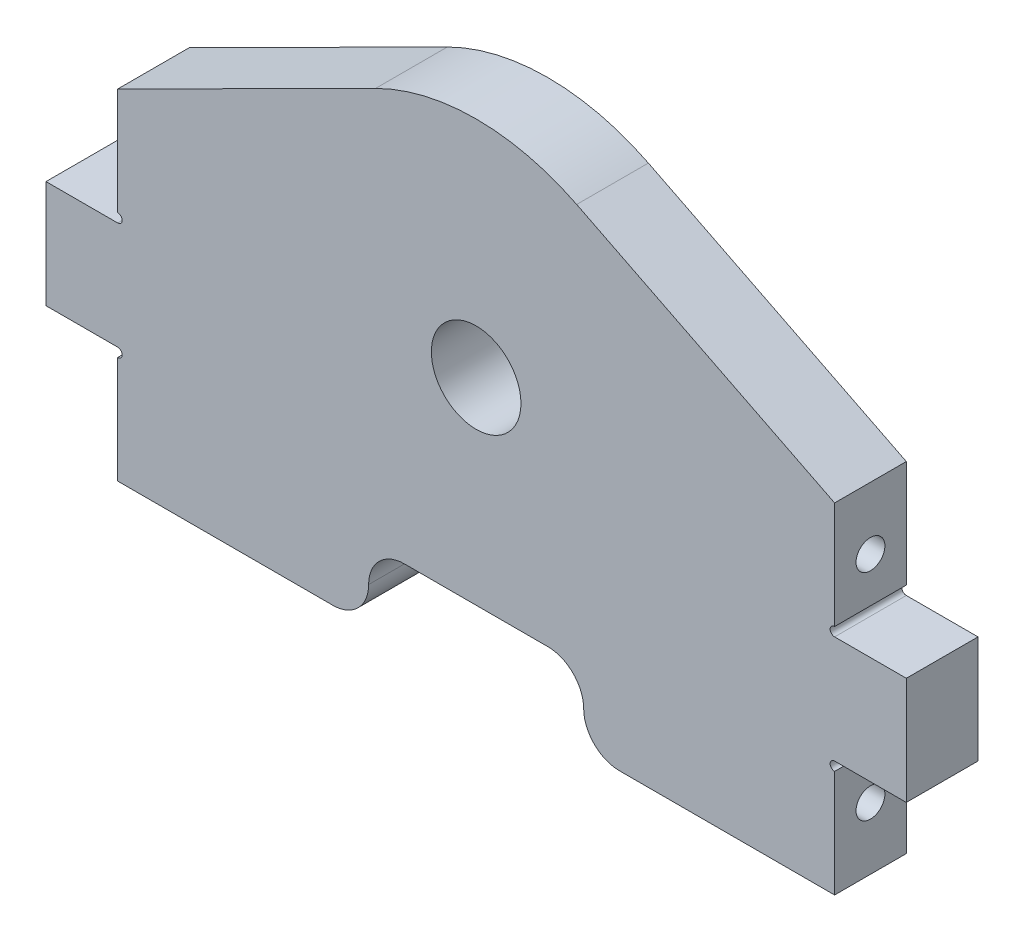
from build123d import *

# Parameters (mm, degrees)
SKETCH1_W                        = 127
SKETCH1_H                        = 152.4
BOSS_EXTRUDE1_DEPTH              = 12.7
SKETCH2_R                        = 7.9375
CUT_EXTRUDE1_DEPTH               = 166.587741092
SKETCH3_W                        = 127
SKETCH3_H                        = 3.175
BOSS_EXTRUDE2_DEPTH              = 12.7
SKETCH4_W                        = 38.1
SKETCH4_H                        = 12.7
CUT_EXTRUDE2_DEPTH               = 107.172778556
FILLET1_R                        = 6.35
F_1_4_20_TAPPED_HOLE1_AT_2_COUNT = 2
F_1_4_20_TAPPED_HOLE1_AT_2_PITCH = 38.1
SKETCH7_W                        = 12.7
SKETCH7_H                        = 19.05
BOSS_EXTRUDE3_DEPTH              = 12.7
SKETCH8_R                        = 0.79375
CUT_EXTRUDE3_DEPTH               = 115.222803793


with BuildPart() as part:
    # Sketch1 → Boss-Extrude1 (new body)
    with BuildSketch(Plane.XY):
        with Locations((0, 76.2)):
            Rectangle(SKETCH1_W, SKETCH1_H)
    extrude(amount=BOSS_EXTRUDE1_DEPTH)

    # Sketch2 → Cut-Extrude1 (cut, through all)
    with BuildSketch(Plane.XY.offset(12.7)):
        with BuildLine():
            Line((-63.5, 152.4), (-63.5, 56.977000238))
            Line((-63.5, 56.977000238), (-17.807704814, 79.918060357))
            ThreePointArc((-17.807704814, 79.918060357), (0, 84.1375), (17.807704814, 79.918060357))
            Line((17.807704814, 79.918060357), (63.5, 56.977000238))
            Line((63.5, 56.977000238), (63.5, 152.4))
            Line((63.5, 152.4), (-63.5, 152.4))
        make_face()
        with Locations((0, 44.45)):
            Circle(SKETCH2_R)
    extrude(amount=-CUT_EXTRUDE1_DEPTH, mode=Mode.SUBTRACT)

    # Sketch3 → Boss-Extrude2 (add)
    with BuildSketch(Plane(origin=(0, 0, 0), x_dir=(-1, 0, 0), z_dir=(0, 0, -1))):
        with Locations((0, -1.5875)):
            Rectangle(SKETCH3_W, SKETCH3_H)
    extrude(amount=-BOSS_EXTRUDE2_DEPTH)

    # Sketch4 → Cut-Extrude2 (cut, through all)
    with BuildSketch(Plane.XY.offset(12.7)):
        with Locations((0, 3.175)):
            Rectangle(SKETCH4_W, SKETCH4_H)
    extrude(amount=-CUT_EXTRUDE2_DEPTH, mode=Mode.SUBTRACT)

    # Fillet1
    fillet1_edges = [part.edges().sort_by_distance(p)[0] for p in [
        (-19.05, 9.525, 6.35),
        (19.05, 9.525, 6.35),
    ]]
    fillet(fillet1_edges, radius=FILLET1_R)
    fillet1_2_edges = [part.edges().sort_by_distance(p)[0] for p in [
        (-19.05, -3.175, 6.35),
        (19.05, -3.175, 6.35),
    ]]
    fillet(fillet1_2_edges, radius=FILLET1_R - 0.0001)  # a hair under: the kernel refuses the full size

    # Sketch5 → 1/4-20 Tapped Hole1 (revolve, cut)
    with BuildSketch(Plane(origin=(63.5, 45.951000119, 6.35), x_dir=(0, 0, -1), z_dir=(0, 1, 0))):
        Polygon((0, 0), (0, 18.043816902), (2.5527, 16.51), (2.5527, 0), align=None)
    f_1_4_20_tapped_hole1 = revolve(axis=Axis((69.85, 45.951000119, 6.35), (-1, 0, 0)), mode=Mode.SUBTRACT)

    # 1/4-20 Tapped Hole1 at 2: 1/4-20 Tapped Hole1 ×2
    with Locations(*[(0, -i * F_1_4_20_TAPPED_HOLE1_AT_2_PITCH, 0) for i in range(1, F_1_4_20_TAPPED_HOLE1_AT_2_COUNT)]):
        add(f_1_4_20_tapped_hole1, mode=Mode.SUBTRACT)

    # Sketch7 → Boss-Extrude3 (add)
    with BuildSketch(Plane(origin=(63.5, 0, 0), x_dir=(0, 0, -1), z_dir=(1, 0, 0))):
        with Locations((-6.35, 26.901000119)):
            Rectangle(SKETCH7_W, SKETCH7_H)
    boss_extrude3 = extrude(amount=BOSS_EXTRUDE3_DEPTH)

    # Sketch8 → Cut-Extrude3 (cut, through all)
    with BuildSketch(Plane.XY.offset(12.7)):
        with Locations((63.5, 37.219750119)):
            Circle(SKETCH8_R)
        with Locations((63.5, 16.582250119)):
            Circle(SKETCH8_R)
    cut_extrude3 = extrude(amount=-CUT_EXTRUDE3_DEPTH, mode=Mode.SUBTRACT)

    # Mirror1: 1/4-20 Tapped Hole1, Boss-Extrude3, Cut-Extrude3 across plane
    add(f_1_4_20_tapped_hole1.mirror(Plane(origin=(0, 0, 0), x_dir=(0, 0, 1), z_dir=(1, 0, 0))), mode=Mode.SUBTRACT)
    add(boss_extrude3.mirror(Plane(origin=(0, 0, 0), x_dir=(0, 0, 1), z_dir=(1, 0, 0))))
    add(cut_extrude3.mirror(Plane(origin=(0, 0, 0), x_dir=(0, 0, 1), z_dir=(1, 0, 0))), mode=Mode.SUBTRACT)

    # Mirror1 copy 1 sketch → Mirror1 copy 1 (revolve, cut)
    with BuildSketch(Plane(origin=(-63.5, 7.851000119, 6.35), x_dir=(0, 0, -1), z_dir=(0, 1, 0))):
        Polygon((0, 0), (0, -18.043816902), (2.5527, -16.51), (2.5527, 0), align=None)
    revolve(axis=Axis((-69.85, 7.851000119, 6.35), (-1, 0, 0)), mode=Mode.SUBTRACT)


solid = part.part
